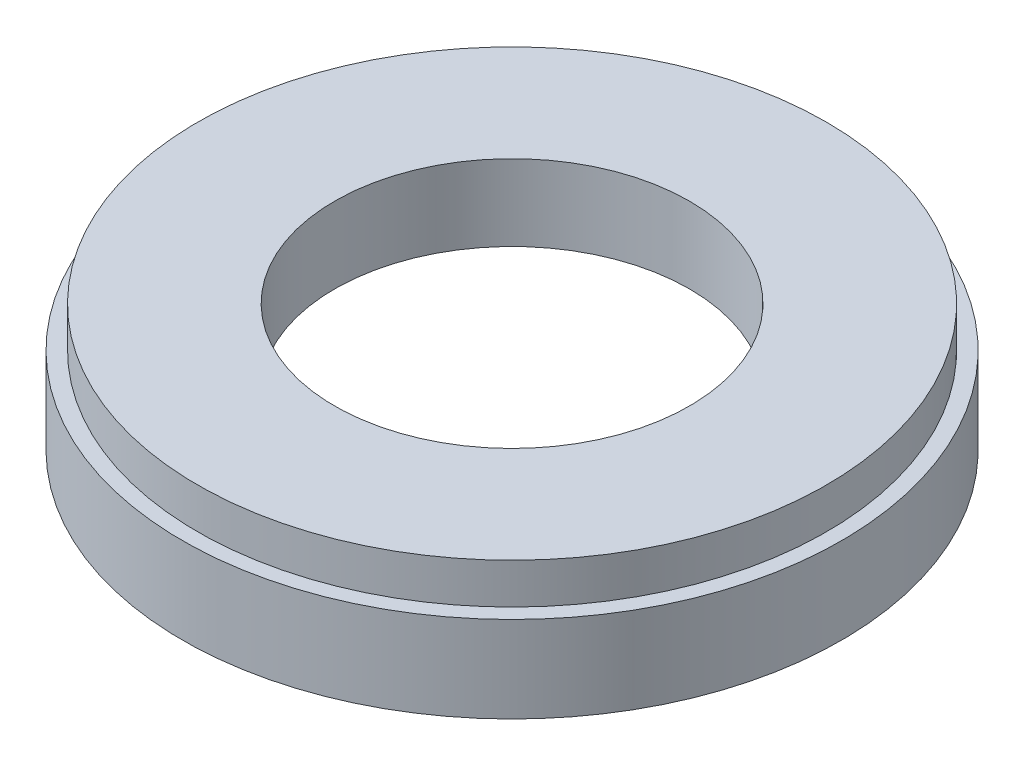
from build123d import *


with BuildPart() as part:
    # Szkic1 → Obrót1 (revolve)
    with BuildSketch(Plane.XY):
        Polygon((-63, 0), (-35, 0), (-35, 15), (-62, 15), (-62, 7), (-65, 7), (-65, -10), (-63, -10), align=None)
    revolve(axis=Axis((0, 0, 0), (0, 1, 0)))


solid = part.part
